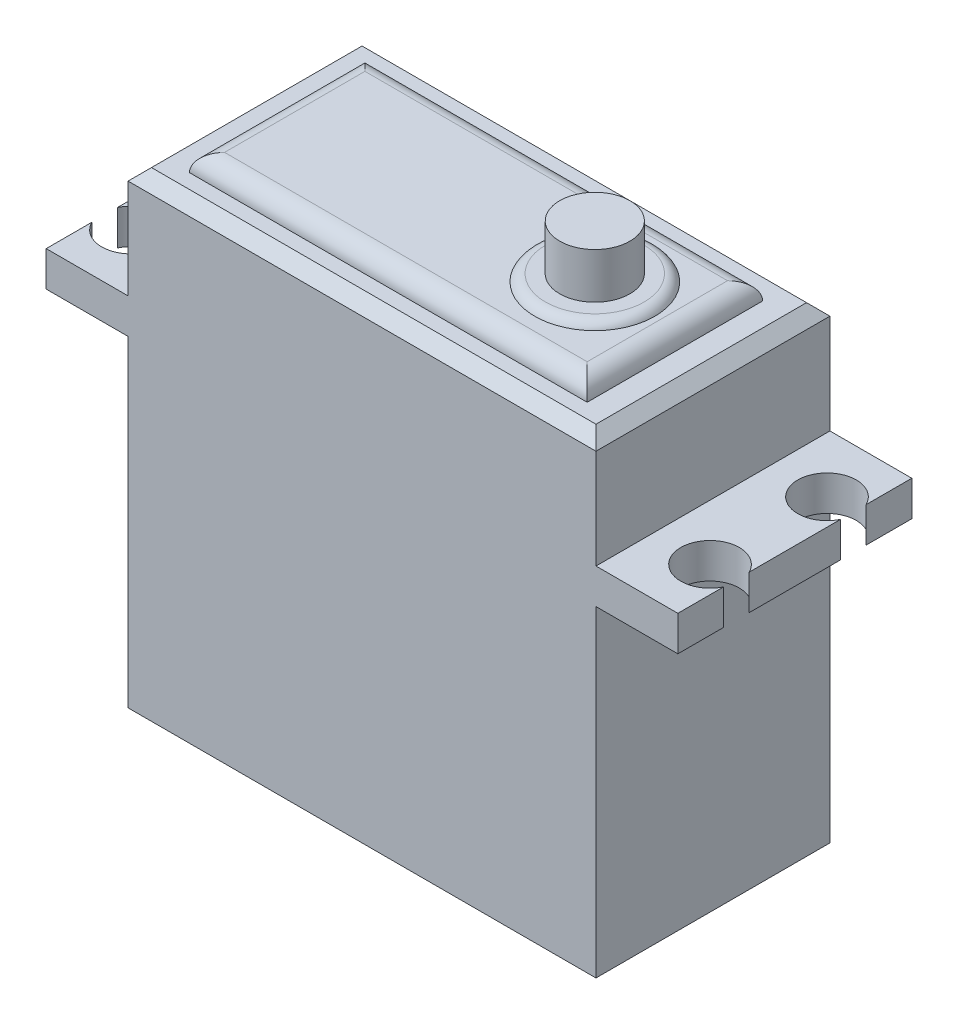
from build123d import *

# Parameters (mm, degrees)
SKETCH_1_W      = 40
SKETCH_1_H      = 20
EXTRUDE_1_DEPTH = 40
EXTRUDE_START   = -27.5
EXTRUDE_4_DEPTH = 3
SKETCH_2_R      = 3
EXTRUDE_5_DEPTH = 6
SKETCH_8_W      = 34
SKETCH_8_H      = 15
EXTRUDE_6_DEPTH = 1.5
FILLET_1_R      = 1.5
SKETCH_9_R      = 5.130323695
EXTRUDE_7_DEPTH = 0.6
FILLET_2_R      = 1
CHAMFER_1_SIZE  = 1


# Some blends are built 0.0001 mm under size
with BuildPart() as part:
    # 草图1 → 凸台-拉伸1 (new body)
    with BuildSketch(Plane(origin=(0, 0, 0), x_dir=(1, 0, 0), z_dir=(0, 1, 0))):
        with Locations((20, -10)):
            Rectangle(SKETCH_1_W, SKETCH_1_H)
    extrude(amount=EXTRUDE_1_DEPTH)

    # 草图7 → 凸台-拉伸4 (add)
    with BuildSketch(Plane.XZ.offset(EXTRUDE_START)):
        with BuildLine():
            Line((40, 20), (47, 20))
            Line((47, 20), (47, 16.089724736))
            ThreePointArc((47, 16.089724736), (42.25, 15), (47, 13.910275264))
            Line((47, 13.910275264), (47, 6.089724736))
            ThreePointArc((47, 6.089724736), (42.25, 5), (47, 3.910275264))
            Line((47, 3.910275264), (47, 0))
            Line((47, 0), (40, 0))
            Line((40, 0), (40, 20))
        make_face()
        with BuildLine():
            Line((0, 20), (0, 0))
            Line((0, 0), (-7, 0))
            Line((-7, 0), (-7, 3.910275264))
            ThreePointArc((-7, 3.910275264), (-2.25, 5), (-7, 6.089724736))
            Line((-7, 6.089724736), (-7, 13.910275264))
            ThreePointArc((-7, 13.910275264), (-2.25, 15), (-7, 16.089724736))
            Line((-7, 16.089724736), (-7, 20))
            Line((-7, 20), (0, 20))
        make_face()
    extrude(amount=-EXTRUDE_4_DEPTH)

    # 草图2 → 凸台-拉伸5 (add)
    with BuildSketch(Plane(origin=(0, 40, 0), x_dir=(1, 0, 0), z_dir=(0, 1, 0))):
        with Locations(Location((29.9, -10, 0), (0, 0, 270))):
            Circle(SKETCH_2_R)
    extrude(amount=EXTRUDE_5_DEPTH)

    # 草图8 → 凸台-拉伸6 (add)
    with BuildSketch(Plane(origin=(0, 40, 0), x_dir=(1, 0, 0), z_dir=(0, 1, 0))):
        with Locations((20, -10.251596062)):
            Rectangle(SKETCH_8_W, SKETCH_8_H)
    extrude(amount=EXTRUDE_6_DEPTH)

    # 圆角1
    fillet_1_edges = [part.edges().sort_by_distance(p)[0] for p in [
        (20, 41.5, 2.751596062),
        (37, 41.5, 10.251596062),
        (20, 41.5, 17.751596062),
        (3, 41.5, 10.251596062),
    ]]
    fillet(fillet_1_edges, radius=FILLET_1_R - 0.0001)  # a hair under: the kernel refuses the full size

    # 草图9 → 凸台-拉伸7 (add)
    with BuildSketch(Plane(origin=(0, 41.5, 0), x_dir=(1, 0, 0), z_dir=(0, 1, 0))):
        with Locations(Location((29.9, -10, 0), (0, 0, 90))):
            Circle(SKETCH_9_R)
    extrude(amount=EXTRUDE_7_DEPTH)

    # 圆角2
    # the kernel refuses this fillet: 1 mm, written as the material it takes off along each edge
    with BuildSketch(Plane(origin=(29.9, 42.1, 10), x_dir=(0, 0, -1), z_dir=(1, 0, 0))) as fillet_2_piece_1:
        with BuildLine():
            CenterArc((4.213808556, -1), FILLET_2_R, 23.578178478, 66.421821522)
            Line((4.213808556, 0), (4.213808556, 0.02))
            Line((4.213808556, 0.02), (5.130323695, 0.02))
            Line((5.130323695, 0.02), (5.150323695, 0))
            ThreePointArc((5.150323695, 0), (5.150323695, -0.3), (5.148653998, -0.592))
            Line((5.148653998, -0.592), (5.130323695, -0.6))
        make_face()
    revolve(axis=Axis((29.9, 42.1, 10), (0, 1, 0)), mode=Mode.SUBTRACT)

    # 倒角1
    chamfer_1_edges = [part.edges().sort_by_distance(p)[0] for p in [
        (40, 40, 10),
        (20, 40, 0),
        (0, 40, 10),
        (20, 40, 20),
    ]]
    chamfer(chamfer_1_edges, length=CHAMFER_1_SIZE)


solid = part.part
